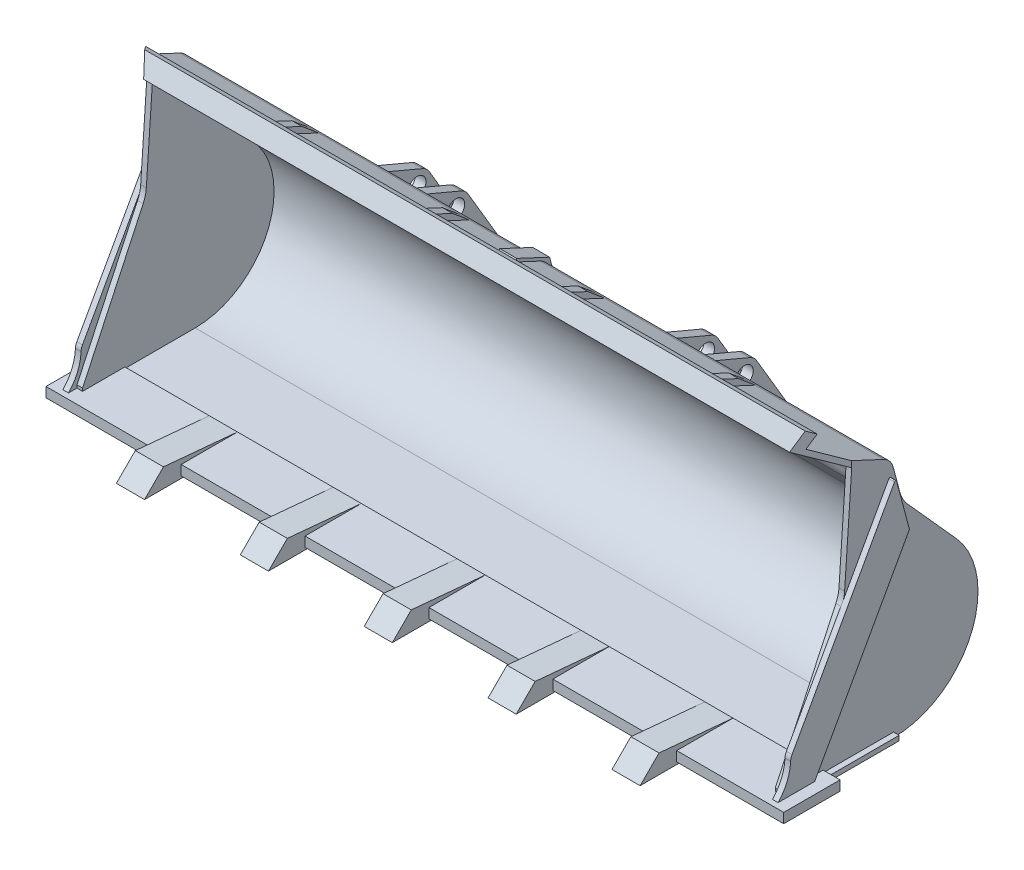
from build123d import *
from OCP.BRepFilletAPI import BRepFilletAPI_MakeChamfer

# Parameters (mm, degrees)
BOSS_EXTRUDE2_DEPTH      = 158.75
FILLET1_R                = 7.62
FILLET2_R                = 15.24
SHELL1_DEPTH             = 156.21
BOSS_EXTRUDE3_DEPTH      = 7.62
BOSS_EXTRUDE3_DEPTH_BACK = 158.75
SKETCH2_W                = 25.4
SKETCH2_H                = 4.445
BOSS_EXTRUDE4_DEPTH      = 2.54
BOSS_EXTRUDE4_DEPTH_BACK = 158.75
SKETCH3_W                = 31.75
SKETCH3_H                = 2.159
BOSS_EXTRUDE5_DEPTH      = 2.54
FILLET3_R                = 5.08
CUT_EXTRUDE2_DEPTH       = 24.88046
FILLET4_R                = 0.508
SKETCH32_W               = 4.445
SKETCH32_H               = 28.196735645
BOSS_EXTRUDE13_DEPTH     = 2.54
CHAMFER2_SIZE            = 2.54
CHAMFER2_SIZE_2          = 9.479409051
BOSS_EXTRUDE14_START     = 3.81
BOSS_EXTRUDE14_DEPTH     = 3.81
SKETCH34_R               = 4.0005
BOSS_EXTRUDE15_DEPTH     = 76.2
SKETCH34_4_R             = 4.0005
CUT_EXTRUDE8_DEPTH       = 53.975
CUT_EXTRUDE9_START       = 65.0875
SKETCH34_5_R             = 4.0005
CUT_EXTRUDE9_DEPTH       = 6.35
CUT_EXTRUDE10_START      = -65.0875
SKETCH34_6_R             = 4.0005
CUT_EXTRUDE10_DEPTH      = 6.35
SKETCH35_W               = 7.62
SKETCH35_H               = 1.447314069
BOSS_EXTRUDE16_DEPTH     = 11.837931251
BOSS_EXTRUDE17_DEPTH     = 1.524
BOSS_EXTRUDE18_DEPTH     = 6.35
LPATTERN4_COUNT          = 3
LPATTERN4_PITCH          = 55.88
LPATTERN5_COPY_1_DEPTH   = 6.35
LPATTERN5_COPY_2_DEPTH   = 6.35
LPATTERN5_COPY_3_DEPTH   = 6.35
LPATTERN5_COPY_4_DEPTH   = 6.35
LPATTERN5_COPY_5_DEPTH   = 6.35
LPATTERN5_COPY_6_DEPTH   = 6.35
SCALE2_SCALE             = 3.922


# Read off the part's stored shape, not the designer's step: Shell1
with BuildPart() as part:
    # Sketch1 → Boss-Extrude2 (new body)
    with BuildSketch(Plane(origin=(0, 0, 0), x_dir=(0, 0, -1), z_dir=(1, 0, 0))):
        with BuildLine():
            Line((-25.4, 0), (25.4, 0))
            ThreePointArc((25.4, 0), (60.194619605, 22.577614663), (53.751469457, 63.551997557))
            Line((53.751469457, 63.551997557), (29.1961477, 90.904642598))
            Line((29.1961477, 90.904642598), (24.292848655, 109.312797272))
            Line((24.292848655, 109.312797272), (-4.462558792, 122.773445196))
            Line((-4.462558792, 122.773445196), (-1.770429207, 128.524526686))
            Line((-1.770429207, 128.524526686), (-4.645969952, 129.870591478))
            Line((-4.645969952, 129.870591478), (-8.41495137, 121.819077393))
            Line((-8.41495137, 121.819077393), (6.537860502, 114.819540472))
            Line((6.537860502, 114.819540472), (3.1365736, 65.406463788))
            Line((3.1365736, 65.406463788), (-25.4, 4.445))
            Line((-25.4, 4.445), (-25.4, 0))
        make_face()
    extrude(amount=BOSS_EXTRUDE2_DEPTH)

    # Fillet1
    fillet1_edges = [part.edges().sort_by_distance(p)[0] for p in [
        (79.375, 109.312797272, -24.292848655),
    ]]
    fillet(fillet1_edges, radius=FILLET1_R)

    # Fillet2
    fillet2_edges = [part.edges().sort_by_distance(p)[0] for p in [
        (79.375, 65.406463788, -3.1365736),
        (79.375, 90.904642598, -29.1961477),
    ]]
    fillet(fillet2_edges, radius=FILLET2_R)

    # Shell1 outline → Shell1 (cut)
    with BuildSketch(Plane.YZ):
        with BuildLine():
            ThreePointArc((105.225478667, -22.75300639), (107.177537705, -21.740493199), (108.518797447, -19.997868812))
            Line((108.518797447, -19.997868812), (114.819540472, -6.537860502))
            Line((114.819540472, -6.537860502), (68.244544144, -3.331929287))
            ThreePointArc((68.244544144, -3.331929287), (65.472423659, -2.881730861), (62.829982956, -1.930501267))
            Line((62.829982956, -1.930501267), (4.445, 25.4))
            Line((4.445, 25.4), (2.54, 25.4))
            Line((2.54, 25.4), (2.54, -25.4))
            ThreePointArc((2.54, -25.4), (23.612440353, -57.874978298), (61.85519772, -51.861371493))
            Line((61.85519772, -51.861371493), (86.485208519, -29.750243332))
            ThreePointArc((86.485208519, -29.750243332), (89.902029769, -27.343037845), (93.786394937, -25.799984717))
            Line((93.786394937, -25.799984717), (105.225478667, -22.75300639))
        make_face()
    extrude(amount=SHELL1_DEPTH, mode=Mode.SUBTRACT)

    # Sketch2 → Boss-Extrude3 (add, two sides: drawn at the far end of the back side and taken through both)
    with BuildSketch(Plane(origin=(158.75, 0, 0), x_dir=(0, 0, -1), z_dir=(1, 0, 0)).offset(-BOSS_EXTRUDE3_DEPTH_BACK)):
        with Locations((-19.05, 0.9525)):
            Rectangle(SKETCH2_W, SKETCH2_H)
    extrude(amount=BOSS_EXTRUDE3_DEPTH + BOSS_EXTRUDE3_DEPTH_BACK)

    # Sketch3 → Boss-Extrude4 (add, two sides: drawn at the far end of the back side and taken through both)
    with BuildSketch(Plane(origin=(158.75, 0, 0), x_dir=(0, 0, -1), z_dir=(1, 0, 0)).offset(-BOSS_EXTRUDE4_DEPTH_BACK)):
        with Locations((9.525, 1.0795)):
            Rectangle(SKETCH3_W, SKETCH3_H)
    extrude(amount=BOSS_EXTRUDE4_DEPTH + BOSS_EXTRUDE4_DEPTH_BACK)

    # Sketch5 → Boss-Extrude5 (add)
    with BuildSketch(Plane(origin=(158.75, 0, 0), x_dir=(0, 0, -1), z_dir=(1, 0, 0))):
        with BuildLine():
            Line((-23.547875004, 17.659520207), (23.912386811, 103.280098999))
            Line((23.912386811, 103.280098999), (30.039204038, 80.278565107))
            Line((30.039204038, 80.278565107), (-12.7, 3.175))
            Line((-12.7, 3.175), (-29.21, 3.175))
            ThreePointArc((-29.21, 3.175), (-24.938604027, 9.854221214), (-23.547875004, 17.659520207))
        make_face()
    extrude(amount=BOSS_EXTRUDE5_DEPTH)

    # Fillet3
    fillet3_edges = [part.edges().sort_by_distance(p)[0] for p in [
        (160.02, 17.659520207, 23.547875004),
    ]]
    fillet(fillet3_edges, radius=FILLET3_R)

    # Sketch10 → Cut-Extrude2 (cut)
    with BuildSketch(Plane(origin=(0, 139.7, 0), x_dir=(1, 0, 0), z_dir=(0, 1, 0))):
        Polygon((158.75, 6.537860502), (158.75, -8.41495137), (145.660513664, -8.41495137), align=None)
    extrude(amount=-CUT_EXTRUDE2_DEPTH, mode=Mode.SUBTRACT)

    # Fillet4
    fillet4_edges = [part.edges().sort_by_distance(p)[0] for p in [
        (160.02, 80.278565107, -30.039204038),
        (160.02, 103.280098999, -23.912386811),
    ]]
    fillet(fillet4_edges, radius=FILLET4_R)

    # Sketch32 → Boss-Extrude13 (add)
    with BuildSketch(Plane(origin=(0, 98.99266809, -46.339299999), x_dir=(1, 0, 0), z_dir=(0, 0.9056821243183001, -0.42395741494906214))):
        with Locations((98.506329037, -41.994004354)):
            Rectangle(SKETCH32_W, SKETCH32_H)
        with Locations((30.561329037, -41.994004354)):
            Rectangle(SKETCH32_W, SKETCH32_H)
    extrude(amount=BOSS_EXTRUDE13_DEPTH)

    # Chamfer2
    chamfer2_edges_1 = [part.edges().sort_by_distance(p)[0] for p in [
        (30.561329037, 113.119662638, -22.15157248),
    ]]
    chamfer2_side_1 = [part.faces().sort_by_distance(p)[0] for p in [
        (30.561329037, 113.073653986, -22.130035443),
    ]]
    chamfer2_edges_2 = [part.edges().sort_by_distance(p)[0] for p in [
        (98.506329037, 113.119662638, -22.15157248),
    ]]
    chamfer2_side_2 = [part.faces().sort_by_distance(p)[0] for p in [
        (98.506329037, 113.073653986, -22.130035443),
    ]]
    chamfer2 = BRepFilletAPI_MakeChamfer(part.part.solid().wrapped)
    for e in chamfer2_edges_1:
        chamfer2.Add(CHAMFER2_SIZE - 0.0001, CHAMFER2_SIZE_2 - 0.0001, e.wrapped, chamfer2_side_1[0].wrapped)
    for e in chamfer2_edges_2:
        chamfer2.Add(CHAMFER2_SIZE - 0.0001, CHAMFER2_SIZE_2 - 0.0001, e.wrapped, chamfer2_side_2[0].wrapped)
    add(Compound.cast(chamfer2.Shape()), mode=Mode.REPLACE)  # a hair under: the kernel refuses the full size

    # Sketch33 → Boss-Extrude14 (add)
    with BuildSketch(Plane(origin=(0, 0, 0), x_dir=(0, 0, -1), z_dir=(1, 0, 0)).offset(BOSS_EXTRUDE14_START)):
        with BuildLine():
            Line((25.217479167, 110.282227953), (29.358894621, 94.734366086))
            Line((29.358894621, 94.734366086), (28.25440534, 94.440168143))
            Line((28.25440534, 94.440168143), (25.207427013, 105.879251873))
            ThreePointArc((25.207427013, 105.879251873), (23.688657226, 108.80734043), (21.074720646, 110.819230042))
            Line((21.074720646, 110.819230042), (9.812888073, 116.090988529))
            Line((9.812888073, 116.090988529), (10.35131399, 117.241204827))
            Line((10.35131399, 117.241204827), (25.217479167, 110.282227953))
        make_face()
    extrude(amount=-BOSS_EXTRUDE14_DEPTH)

    # Mirror2: part across plane


with BuildPart() as part_1:
    add(part.part)
    add(part.part.mirror(Plane(origin=(0, 38.1, -25.4), x_dir=(0, 0, 1), z_dir=(-1, 0, 0))))

    # Sketch34 → Boss-Extrude15 (add, symmetric)
    with BuildSketch(Plane(origin=(0, 0, 0), x_dir=(0, 0, -1), z_dir=(1, 0, 0))):
        with BuildLine():
            Line((-6.35, -1.27), (-6.35, 0))
            Line((-6.35, 0), (25.4, 0))
            ThreePointArc((25.4, 0), (60.194619605, 22.577614663), (53.751469457, 63.551997557))
            Line((53.751469457, 63.551997557), (31.640341296, 88.182008356))
            ThreePointArc((31.640341296, 88.182008356), (29.577022307, 91.110712285), (28.25440534, 94.440168143))
            Line((28.25440534, 94.440168143), (25.207427013, 105.879251873))
            Line((25.207427013, 105.879251873), (43.161870774, 98.286286826))
            ThreePointArc((43.161870774, 98.286286826), (44.870430539, 97.21628887), (46.157499535, 95.664668589))
            Line((46.157499535, 95.664668589), (68.530987489, 57.745818442))
            ThreePointArc((68.530987489, 57.745818442), (68.917086777, 56.97669472), (69.19564295, 56.162427923))
            Line((69.19564295, 56.162427923), (82.510822606, 6.469500936))
            ThreePointArc((82.510822606, 6.469500936), (81.41498732, 0.960364926), (76.377193609, -1.524))
            Line((76.377193609, -1.524), (-6.35, -1.524))
            Line((-6.35, -1.524), (-6.35, -1.27))
        make_face()
        with Locations(Location((40.688525999, 92.437777134, 0), (0, 0, 180))):
            Circle(SKETCH34_R, mode=Mode.SUBTRACT)
        with Locations(Location((76.377193609, 4.826, 0), (0, 0, 180))):
            Circle(SKETCH34_R, mode=Mode.SUBTRACT)
    extrude(amount=BOSS_EXTRUDE15_DEPTH, both=True)

    # Sketch34<4> → Cut-Extrude8 (cut, symmetric)
    with BuildSketch(Plane(origin=(0, 0, 0), x_dir=(0, 0, -1), z_dir=(1, 0, 0))):
        with BuildLine():
            Line((-6.35, -1.27), (-6.35, 0))
            Line((-6.35, 0), (25.4, 0))
            ThreePointArc((25.4, 0), (60.194619605, 22.577614663), (53.751469457, 63.551997557))
            Line((53.751469457, 63.551997557), (31.640341296, 88.182008356))
            ThreePointArc((31.640341296, 88.182008356), (29.577022307, 91.110712285), (28.25440534, 94.440168143))
            Line((28.25440534, 94.440168143), (25.207427013, 105.879251873))
            Line((25.207427013, 105.879251873), (43.161870774, 98.286286826))
            ThreePointArc((43.161870774, 98.286286826), (44.870430539, 97.21628887), (46.157499535, 95.664668589))
            Line((46.157499535, 95.664668589), (68.530987489, 57.745818442))
            ThreePointArc((68.530987489, 57.745818442), (68.917086777, 56.97669472), (69.19564295, 56.162427923))
            Line((69.19564295, 56.162427923), (82.510822606, 6.469500936))
            ThreePointArc((82.510822606, 6.469500936), (81.41498732, 0.960364926), (76.377193609, -1.524))
            Line((76.377193609, -1.524), (-6.35, -1.524))
            Line((-6.35, -1.524), (-6.35, -1.27))
        make_face()
        with Locations(Location((40.688525999, 92.437777134, 0), (0, 0, 180))):
            Circle(SKETCH34_4_R, mode=Mode.SUBTRACT)
        with Locations(Location((76.377193609, 4.826, 0), (0, 0, 180))):
            Circle(SKETCH34_4_R, mode=Mode.SUBTRACT)
    extrude(amount=CUT_EXTRUDE8_DEPTH, both=True, mode=Mode.SUBTRACT)

    # Sketch34<5> → Cut-Extrude9 (cut, symmetric)
    with BuildSketch(Plane(origin=(0, 0, 0), x_dir=(0, 0, -1), z_dir=(1, 0, 0)).offset(CUT_EXTRUDE9_START)):
        with BuildLine():
            Line((-6.35, -1.27), (-6.35, 0))
            Line((-6.35, 0), (25.4, 0))
            ThreePointArc((25.4, 0), (60.194619605, 22.577614663), (53.751469457, 63.551997557))
            Line((53.751469457, 63.551997557), (31.640341296, 88.182008356))
            ThreePointArc((31.640341296, 88.182008356), (29.577022307, 91.110712285), (28.25440534, 94.440168143))
            Line((28.25440534, 94.440168143), (25.207427013, 105.879251873))
            Line((25.207427013, 105.879251873), (43.161870774, 98.286286826))
            ThreePointArc((43.161870774, 98.286286826), (44.870430539, 97.21628887), (46.157499535, 95.664668589))
            Line((46.157499535, 95.664668589), (68.530987489, 57.745818442))
            ThreePointArc((68.530987489, 57.745818442), (68.917086777, 56.97669472), (69.19564295, 56.162427923))
            Line((69.19564295, 56.162427923), (82.510822606, 6.469500936))
            ThreePointArc((82.510822606, 6.469500936), (81.41498732, 0.960364926), (76.377193609, -1.524))
            Line((76.377193609, -1.524), (-6.35, -1.524))
            Line((-6.35, -1.524), (-6.35, -1.27))
        make_face()
        with Locations(Location((40.688525999, 92.437777134, 0), (0, 0, 180))):
            Circle(SKETCH34_5_R, mode=Mode.SUBTRACT)
        with Locations(Location((76.377193609, 4.826, 0), (0, 0, 180))):
            Circle(SKETCH34_5_R, mode=Mode.SUBTRACT)
    extrude(amount=CUT_EXTRUDE9_DEPTH, both=True, mode=Mode.SUBTRACT)

    # Sketch34<6> → Cut-Extrude10 (cut, symmetric)
    with BuildSketch(Plane(origin=(0, 0, 0), x_dir=(0, 0, -1), z_dir=(1, 0, 0)).offset(CUT_EXTRUDE10_START)):
        with BuildLine():
            Line((-6.35, -1.27), (-6.35, 0))
            Line((-6.35, 0), (25.4, 0))
            ThreePointArc((25.4, 0), (60.194619605, 22.577614663), (53.751469457, 63.551997557))
            Line((53.751469457, 63.551997557), (31.640341296, 88.182008356))
            ThreePointArc((31.640341296, 88.182008356), (29.577022307, 91.110712285), (28.25440534, 94.440168143))
            Line((28.25440534, 94.440168143), (25.207427013, 105.879251873))
            Line((25.207427013, 105.879251873), (43.161870774, 98.286286826))
            ThreePointArc((43.161870774, 98.286286826), (44.870430539, 97.21628887), (46.157499535, 95.664668589))
            Line((46.157499535, 95.664668589), (68.530987489, 57.745818442))
            ThreePointArc((68.530987489, 57.745818442), (68.917086777, 56.97669472), (69.19564295, 56.162427923))
            Line((69.19564295, 56.162427923), (82.510822606, 6.469500936))
            ThreePointArc((82.510822606, 6.469500936), (81.41498732, 0.960364926), (76.377193609, -1.524))
            Line((76.377193609, -1.524), (-6.35, -1.524))
            Line((-6.35, -1.524), (-6.35, -1.27))
        make_face()
        with Locations(Location((40.688525999, 92.437777134, 0), (0, 0, 180))):
            Circle(SKETCH34_6_R, mode=Mode.SUBTRACT)
        with Locations(Location((76.377193609, 4.826, 0), (0, 0, 180))):
            Circle(SKETCH34_6_R, mode=Mode.SUBTRACT)
    extrude(amount=CUT_EXTRUDE10_DEPTH, both=True, mode=Mode.SUBTRACT)

    # Sketch35 → Boss-Extrude16 (add, along a direction that is not the sketch's normal)
    with BuildSketch(Plane(origin=(0, 98.858994144, -41.807638104), x_dir=(1, 0, 0), z_dir=(0, -0.9210251484074462, 0.38950311423792466))):
        with Locations((0, 17.299967098)):
            Rectangle(SKETCH35_W, SKETCH35_H)
    extrude(amount=BOSS_EXTRUDE16_DEPTH, dir=(0, -0.9663073319302178, -0.25739102598556934))

    # Sketch36 → Boss-Extrude17 (add)
    with BuildSketch(Plane.XZ):
        with BuildLine():
            Line((-71.4375, -25.4), (-71.4375, 6.35))
            Line((-71.4375, 6.35), (-58.7375, 6.35))
            Line((-58.7375, 6.35), (-58.7375, -25.4))
            ThreePointArc((-58.7375, -25.4), (-65.0875, -19.05), (-71.4375, -25.4))
        make_face()
        with BuildLine():
            Line((71.4375, -25.4), (71.4375, 6.35))
            Line((71.4375, 6.35), (58.7375, 6.35))
            Line((58.7375, 6.35), (58.7375, -25.4))
            ThreePointArc((58.7375, -25.4), (65.0875, -19.05), (71.4375, -25.4))
        make_face()
    extrude(amount=BOSS_EXTRUDE17_DEPTH)

    # Sketch37 → Boss-Extrude18 (add, symmetric)
    with BuildSketch(Plane(origin=(0, 0, 0), x_dir=(0, 0, -1), z_dir=(1, 0, 0))):
        Polygon((-39.728756685, 6.245243315), (-6.35, 3.175), (-6.35, -2.286), (-48.26, -2.286), align=None)
    boss_extrude18 = extrude(amount=BOSS_EXTRUDE18_DEPTH, both=True)

    # LPattern4: Boss-Extrude18 ×3
    with Locations(*[(-i * LPATTERN4_PITCH, 0, 0) for i in range(1, LPATTERN4_COUNT)]):
        add(boss_extrude18)

    # LPattern5 copy 1 sketch → LPattern5 copy 1 (add, symmetric)
    with BuildSketch(Plane(origin=(0, 0, 0), x_dir=(0, 0, -1), z_dir=(1, 0, 0))):
        Polygon((-39.728756685, 6.245243315), (-6.35, 3.175), (-6.35, -2.286), (-48.26, -2.286), align=None)
    extrude(amount=LPATTERN5_COPY_1_DEPTH, both=True)

    # LPattern5 copy 2 sketch → LPattern5 copy 2 (add, symmetric)
    with BuildSketch(Plane(origin=(55.88, 0, 0), x_dir=(0, 0, -1), z_dir=(1, 0, 0))):
        Polygon((-39.728756685, 6.245243315), (-6.35, 3.175), (-6.35, -2.286), (-48.26, -2.286), align=None)
    extrude(amount=LPATTERN5_COPY_2_DEPTH, both=True)

    # LPattern5 copy 3 sketch → LPattern5 copy 3 (add, symmetric)
    with BuildSketch(Plane(origin=(-55.88, 0, 0), x_dir=(0, 0, -1), z_dir=(1, 0, 0))):
        Polygon((-39.728756685, 6.245243315), (-6.35, 3.175), (-6.35, -2.286), (-48.26, -2.286), align=None)
    extrude(amount=LPATTERN5_COPY_3_DEPTH, both=True)

    # LPattern5 copy 4 sketch → LPattern5 copy 4 (add, symmetric)
    with BuildSketch(Plane(origin=(0, 0, 0), x_dir=(0, 0, -1), z_dir=(1, 0, 0))):
        Polygon((-39.728756685, 6.245243315), (-6.35, 3.175), (-6.35, -2.286), (-48.26, -2.286), align=None)
    extrude(amount=LPATTERN5_COPY_4_DEPTH, both=True)

    # LPattern5 copy 5 sketch → LPattern5 copy 5 (add, symmetric)
    with BuildSketch(Plane(origin=(55.88, 0, 0), x_dir=(0, 0, -1), z_dir=(1, 0, 0))):
        Polygon((-39.728756685, 6.245243315), (-6.35, 3.175), (-6.35, -2.286), (-48.26, -2.286), align=None)
    extrude(amount=LPATTERN5_COPY_5_DEPTH, both=True)

    # LPattern5 copy 6 sketch → LPattern5 copy 6 (add, symmetric)
    with BuildSketch(Plane(origin=(111.76, 0, 0), x_dir=(0, 0, -1), z_dir=(1, 0, 0))):
        Polygon((-39.728756685, 6.245243315), (-6.35, 3.175), (-6.35, -2.286), (-48.26, -2.286), align=None)
    extrude(amount=LPATTERN5_COPY_6_DEPTH, both=True)


with BuildPart() as part_2:
    # Scale2: scaled about (0, 43.416341294, -24.339955138)
    add(part_1.part.scale(SCALE2_SCALE).moved(Location((0, -126.862549261, 71.121348913))))


solid = part_2.part
